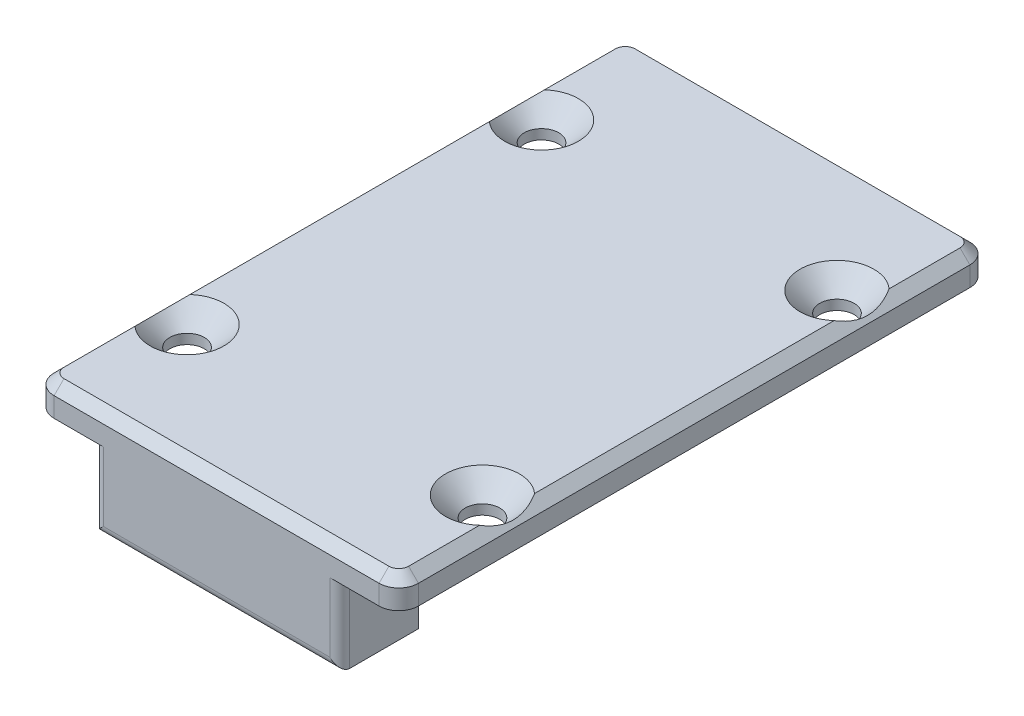
from build123d import *

# Parameters (mm, degrees)
SKETCH_1_W          = 37
SKETCH_1_H          = 60
EXTRUDE_1_DEPTH     = 3
SKETCH_2_R          = 1.75
CUT_EXTRUDE_1_DEPTH = 3
FILLET_1_R          = 2
SKETCH_3_W          = 25
SKETCH_3_H          = 8
EXTRUDE_2_DEPTH     = 8
FILLET_2_R          = 1
CHAMFER_2_SIZE      = 1
CHAMFER_1_SIZE      = 2


with BuildPart() as part:
    # Эскиз1 → Бобышка-Вытянуть1 (new body)
    with BuildSketch(Plane(origin=(0, 0, 0), x_dir=(1, 0, 0), z_dir=(0, 1, 0))):
        Rectangle(SKETCH_1_W, SKETCH_1_H)
    extrude(amount=EXTRUDE_1_DEPTH)

    # Эскиз2 → Вырез-Вытянуть1 (cut)
    with BuildSketch(Plane(origin=(0, 3, 0), x_dir=(1, 0, 0), z_dir=(0, 1, 0))):
        with Locations(Location((15, 18, 0), (0, 0, 270))):
            Circle(SKETCH_2_R)
        with Locations(Location((15, -18, 0), (0, 0, 90))):
            Circle(SKETCH_2_R)
        with Locations(Location((-15, -18, 0), (0, 0, 270))):
            Circle(SKETCH_2_R)
        with Locations(Location((-15, 18, 0), (0, 0, 90))):
            Circle(SKETCH_2_R)
    extrude(amount=-CUT_EXTRUDE_1_DEPTH, mode=Mode.SUBTRACT)

    # Скругление1
    fillet_1_edges = [part.edges().sort_by_distance(p)[0] for p in [
        (18.5, 1.5, 30),
        (-18.5, 1.5, 30),
        (-18.5, 1.5, -30),
        (18.5, 1.5, -30),
    ]]
    fillet(fillet_1_edges, radius=FILLET_1_R)

    # Эскиз3 → Бобышка-Вытянуть2 (add)
    with BuildSketch(Plane.XZ):
        with Locations((0, 26)):
            Rectangle(SKETCH_3_W, SKETCH_3_H)
    extrude(amount=EXTRUDE_2_DEPTH)

    # Скругление2
    fillet_2_edges = [part.edges().sort_by_distance(p)[0] for p in [
        (12.5, -4, 30),
        (-12.5, -4, 30),
        (0, -8, 30),
    ]]
    fillet(fillet_2_edges, radius=FILLET_2_R)

    # Фаска2
    chamfer_2_edges = [part.edges().sort_by_distance(p)[0] for p in [
        (0, 3, -30),
        (18.5, 3, 0),
        (-18.5, 3, 0),
        (0, 3, 30),
        (17.914213562, 3, 29.414213562),
        (-17.914213562, 3, 29.414213562),
        (-17.914213562, 3, -29.414213562),
        (17.914213562, 3, -29.414213562),
    ]]
    chamfer(chamfer_2_edges, length=CHAMFER_2_SIZE)

    # Фаска1
    # the kernel refuses this chamfer: 2 mm, written as the material it takes off along each edge
    with BuildSketch(Plane(origin=(-15, 3, -18), x_dir=(0, 0, -1), z_dir=(1, 0, 0))) as chamfer_1_piece_1:
        Polygon((1.75 + CHAMFER_1_SIZE, 0), (1.75, -CHAMFER_1_SIZE), (1.75, 0), align=None)
    revolve(axis=Axis((-15, 3, -18), (0, 1, 0)), mode=Mode.SUBTRACT)
    with BuildSketch(Plane(origin=(-15, 3, 18), x_dir=(0, 0, 1), z_dir=(-1, 0, 0))) as chamfer_1_piece_2:
        Polygon((1.75 + CHAMFER_1_SIZE, 0), (1.75, -CHAMFER_1_SIZE), (1.75, 0), align=None)
    revolve(axis=Axis((-15, 3, 18), (0, 1, 0)), mode=Mode.SUBTRACT)
    with BuildSketch(Plane(origin=(15, 3, 18), x_dir=(0, 0, -1), z_dir=(1, 0, 0))) as chamfer_1_piece_3:
        Polygon((1.75 + CHAMFER_1_SIZE, 0), (1.75, -CHAMFER_1_SIZE), (1.75, 0), align=None)
    revolve(axis=Axis((15, 3, 18), (0, 1, 0)), mode=Mode.SUBTRACT)
    with BuildSketch(Plane(origin=(15, 3, -18), x_dir=(0, 0, 1), z_dir=(-1, 0, 0))) as chamfer_1_piece_4:
        Polygon((1.75 + CHAMFER_1_SIZE, 0), (1.75, -CHAMFER_1_SIZE), (1.75, 0), align=None)
    revolve(axis=Axis((15, 3, -18), (0, 1, 0)), mode=Mode.SUBTRACT)


solid = part.part
